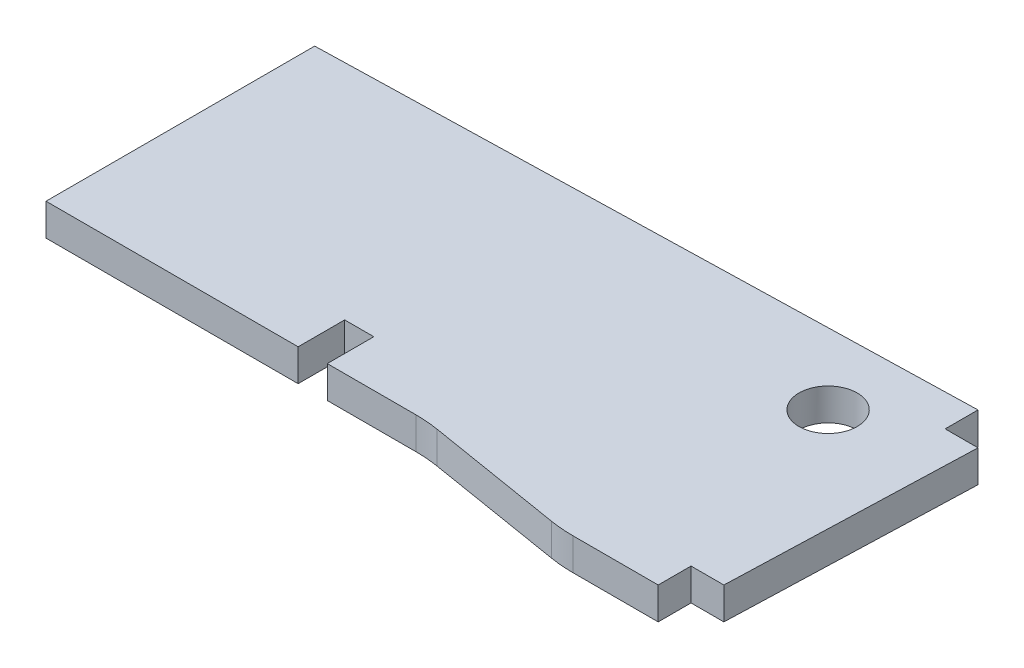
from build123d import *

# Parameters (mm, degrees)
BOSS_EXTRUDE1_DEPTH = 2.8448
FILLET1_R           = 12.7
CUT_EXTRUDE1_REACH  = 67.623
SKETCH2_W           = 2.5908
SKETCH2_H           = 4.1402
CUT_EXTRUDE2_REACH  = 67.623
SKETCH3_R           = 2.5908


with BuildPart() as part:
    # Sketch1 → Boss-Extrude1 (new body)
    with BuildSketch(Plane(origin=(0, 0, 0), x_dir=(1, 0, 0), z_dir=(0, 1, 0))):
        Polygon((0, 0), (0, 23.9014), (57.531, 25.3746), (57.531, 22.4536), (60.452, 22.4536), (59.7154, 0.5842), (56.7944, 0.5842), (56.7944, -2.3368), (48.1584, -2.3368), (33.9344, 0), align=None)
    extrude(amount=BOSS_EXTRUDE1_DEPTH)

    # Fillet1
    fillet1_edges = [part.edges().sort_by_distance(p)[0] for p in [
        (48.1584, 1.4224, 2.3368),
        (33.9344, 1.4224, 0),
    ]]
    fillet(fillet1_edges, radius=FILLET1_R)

    # Sketch2 → Cut-Extrude1 (cut, up to next)
    with BuildSketch(Plane(origin=(0, 2.8448, 0), x_dir=(1, 0, 0), z_dir=(0, 1, 0)), mode=Mode.PRIVATE) as cut_extrude1_sk1:
        with Locations((23.7236, 2.0701)):
            Rectangle(SKETCH2_W, SKETCH2_H)
    cut_extrude1_tool1 = extrude(cut_extrude1_sk1.sketch, amount=-CUT_EXTRUDE1_REACH, mode=Mode.PRIVATE) & part.part
    add(cut_extrude1_tool1.solids().sort_by_distance((23.7236, 2.8448, -2.0701))[0], mode=Mode.SUBTRACT)

    # Sketch3 → Cut-Extrude2 (cut, up to next)
    with BuildSketch(Plane(origin=(0, 2.8448, 0), x_dir=(1, 0, 0), z_dir=(0, 1, 0)), mode=Mode.PRIVATE) as cut_extrude2_sk1:
        with Locations((50.8508, 18.7198)):
            Circle(SKETCH3_R)
    cut_extrude2_tool1 = extrude(cut_extrude2_sk1.sketch, amount=-CUT_EXTRUDE2_REACH, mode=Mode.PRIVATE) & part.part
    add(cut_extrude2_tool1.solids().sort_by_distance((50.8508, 2.8448, -18.7198))[0], mode=Mode.SUBTRACT)


solid = part.part
